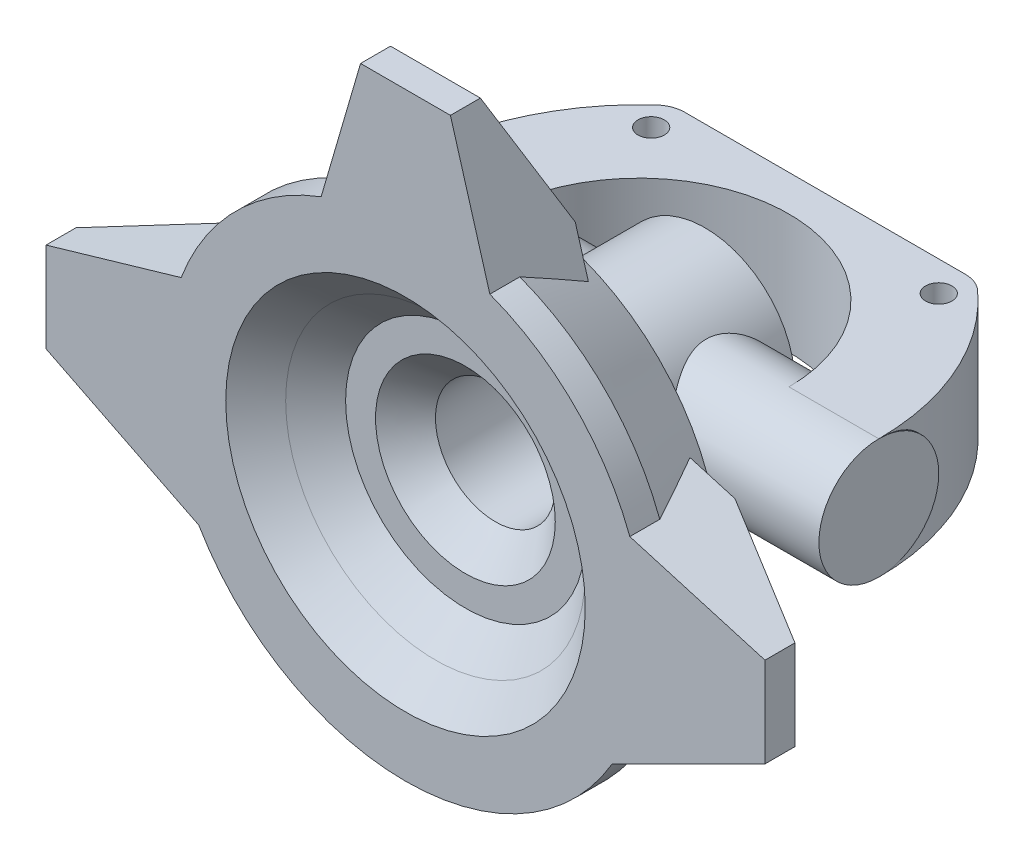
from build123d import *
from OCP.BRepFilletAPI import BRepFilletAPI_MakeChamfer

# Parameters (mm, degrees)
BOSS_EXTRUDE1_DEPTH      = 15
SKETCH7_W                = 80
SKETCH7_H                = 10
BOSS_EXTRUDE2_DEPTH      = 10
BOSS_EXTRUDE2_DEPTH_BACK = 10
SKETCH9_R                = 2.2
CUT_EXTRUDE1_DEPTH       = 112.090053631
SKETCH10_W               = 95.684901594
SKETCH10_H               = 26.722810355
CUT_EXTRUDE2_DEPTH       = 112.090053631
FILLET1_R                = 5
CHAMFER2_SIZE            = 20
CHAMFER2_SIZE2           = 10
SKETCH11_R               = 25
CUT_EXTRUDE3_DEPTH       = 10
CUT_EXTRUDE4_START       = -3
SKETCH12_R               = 10
CUT_EXTRUDE4_DEPTH       = 96.488578018
CHAMFER3_SIZE            = 5


with BuildPart() as part:
    # Sketch3 → Revolve1 (revolve)
    with BuildSketch(Plane(origin=(0, 0, 0), x_dir=(0, 0, -1), z_dir=(1, 0, 0)), mode=Mode.PRIVATE) as revolve1_sk:
        Polygon((0, 0), (0, 40), (5, 40), (17.5, 35), (20, 31), (20, 25), (30, 15), (50, 15), (50, 0), align=None)
    revolve(revolve1_sk.sketch.rotate(Axis((0, 0, 0), (0, 0, -1)), 90), axis=Axis((0, 0, 0), (0, 0, -1)))

    # Sketch4 → Boss-Extrude1 (add)
    with BuildSketch(Plane.XY):
        Polygon((-7.5, 60), (-14.08, 37.44), (-18.332692156, 22.85934118), (18.332692156, 22.85934118), (14.08, 37.44), (7.5, 60), align=None)
        Polygon((-60, 7.5), (-60, -7.5), (-34.503873412, -20.23567937), (-11.543881499, -31.704523248), (-15.96656597, 20.343084925), (-37.44, 14.08), align=None)
        Polygon((60, 7.5), (60, -7.5), (34.503873412, -20.23567937), (8.968081078, -32.991172347), (18.608709293, 19.57245979), (37.44, 14.08), align=None)
    extrude(amount=-BOSS_EXTRUDE1_DEPTH)

    # Sketch7 → Revolve3 (revolve)
    with BuildSketch(Plane(origin=(0, 0, 0), x_dir=(1, 0, 0), z_dir=(0, 1, 0)), mode=Mode.PRIVATE) as revolve3_sk:
        with Locations((0, 44)):
            Rectangle(SKETCH7_W, SKETCH7_H)
    revolve(revolve3_sk.sketch.rotate(Axis((24.146644764, 0, -39), (1, 0, 0)), 180), axis=Axis((24.146644764, 0, -39), (1, 0, 0)))

    # Sketch8 → Boss-Extrude2 (add, two sides: drawn at the far end of the back side and taken through both)
    with BuildSketch(Plane(origin=(0, 0, 0), x_dir=(1, 0, 0), z_dir=(0, 1, 0)).offset(-BOSS_EXTRUDE2_DEPTH_BACK)):
        with BuildLine():
            Line((-40, 39), (-25, 39))
            ThreePointArc((-25, 39), (0, 64), (25, 39))
            Line((25, 39), (40, 39))
            ThreePointArc((40, 39), (0, 79), (-40, 39))
        make_face()
    extrude(amount=BOSS_EXTRUDE2_DEPTH + BOSS_EXTRUDE2_DEPTH_BACK)

    # Sketch9 → Cut-Extrude1 (cut, through all)
    with BuildSketch(Plane(origin=(0, 10, 0), x_dir=(1, 0, 0), z_dir=(0, 1, 0))):
        with Locations(Location((-24, 65, 0), (0, 0, 270))):
            Circle(SKETCH9_R)
        with Locations(Location((24, 65, 0), (0, 0, 270))):
            Circle(SKETCH9_R)
    extrude(amount=-CUT_EXTRUDE1_DEPTH, mode=Mode.SUBTRACT)

    # Sketch10 → Cut-Extrude2 (cut, through all)
    with BuildSketch(Plane(origin=(0, 10, 0), x_dir=(1, 0, 0), z_dir=(0, 1, 0))):
        with Locations((-3.448104562, 83.361405178)):
            Rectangle(SKETCH10_W, SKETCH10_H)
    extrude(amount=-CUT_EXTRUDE2_DEPTH, mode=Mode.SUBTRACT)

    # Fillet1
    fillet1_edges = [part.edges().sort_by_distance(p)[0] for p in [
        (25.27844932, 0, -70),
        (-25.27844932, 0, -70),
    ]]
    fillet(fillet1_edges, radius=FILLET1_R)

    # Chamfer2: one chamfer whose edges measure the first distance from different faces: ONE call of the kernel's chamfer builder (chamfer() names one face for all edges)
    chamfer2_edges_1 = [part.edges().sort_by_distance(p)[0] for p in [
        (0, 60, -15),
    ]]
    chamfer2_side_1 = [part.faces().sort_by_distance(p)[0] for p in [
        (0, 46.053658767, -15),
    ]]
    chamfer2_edges_2 = [part.edges().sort_by_distance(p)[0] for p in [
        (-60, 0, -15),
    ]]
    chamfer2_side_2 = [part.faces().sort_by_distance(p)[0] for p in [
        (-45.196655849, -2.213116141, -15),
    ]]
    chamfer2_edges_3 = [part.edges().sort_by_distance(p)[0] for p in [
        (60, 0, -15),
    ]]
    chamfer2_side_3 = [part.faces().sort_by_distance(p)[0] for p in [
        (45.196655849, -2.213116141, -15),
    ]]
    chamfer2 = BRepFilletAPI_MakeChamfer(part.part.solid().wrapped)
    for e in chamfer2_edges_1:
        chamfer2.Add(CHAMFER2_SIZE, CHAMFER2_SIZE2, e.wrapped, chamfer2_side_1[0].wrapped)  # the first distance lies on this face
    for e in chamfer2_edges_2:
        chamfer2.Add(CHAMFER2_SIZE, CHAMFER2_SIZE2, e.wrapped, chamfer2_side_2[0].wrapped)  # the first distance lies on this face
    for e in chamfer2_edges_3:
        chamfer2.Add(CHAMFER2_SIZE, CHAMFER2_SIZE2, e.wrapped, chamfer2_side_3[0].wrapped)  # the first distance lies on this face
    add(Compound.cast(chamfer2.Shape()), mode=Mode.REPLACE)

    # Sketch11 → Cut-Extrude3 (cut)
    with BuildSketch(Plane.XY):
        Circle(SKETCH11_R)
    extrude(amount=-CUT_EXTRUDE3_DEPTH, mode=Mode.SUBTRACT)

    # Sketch12 → Cut-Extrude4 (cut, through all)
    with BuildSketch(Plane(origin=(0, 0, -50), x_dir=(-1, 0, 0), z_dir=(0, 0, -1)).offset(CUT_EXTRUDE4_START)):
        Circle(SKETCH12_R)
    extrude(amount=-CUT_EXTRUDE4_DEPTH, mode=Mode.SUBTRACT)

    # Chamfer3
    chamfer3_edges = [part.edges().sort_by_distance(p)[0] for p in [
        (-25, 0, 0),
        (-25, 0, -10),
        (10, 0, -10),
    ]]
    chamfer(chamfer3_edges, length=CHAMFER3_SIZE - 0.0001)  # a hair under: the kernel refuses the full size


solid = part.part
